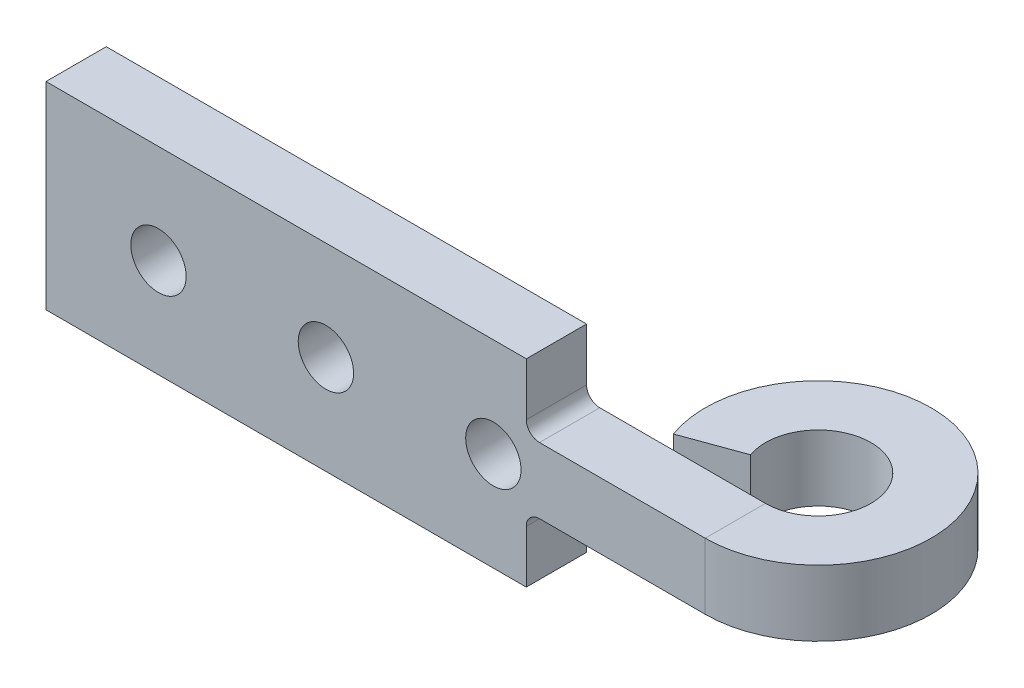
from build123d import *

# Parameters (mm, degrees)
BASE_FLANGE1_DEPTH      = 15
CUT_EXTRUDE1_DEPTH      = 14
CUT_EXTRUDE1_DEPTH_BACK = 10
SKETCH6_W               = 22.14
SKETCH6_H               = 5
SKETCH7_R               = 2.1
CUT_EXTRUDE2_DEPTH      = 10
FILLET2_R               = 1


# Sheet-metal steps are written as plain solids
with BuildPart() as part:
    # Sketch1 → Base-Flange1 (new body)
    with BuildSketch(Plane(origin=(0, 0, 0), x_dir=(1, 0, 0), z_dir=(0, 1, 0))):
        with BuildLine():
            Line((0, 0), (50, 0))
            ThreePointArc((50, 0), (52.294305745, 7.276608177), (46.241229517, 2.631919427))
            Line((46.241229517, 2.631919427), (41.94683424, 1.068887372))
            ThreePointArc((41.94683424, 1.068887372), (54.91555006, 11.02013302), (50, -4.57))
            Line((50, -4.57), (0, -4.57))
            Line((0, -4.57), (0, 0))
        make_face()
    extrude(amount=BASE_FLANGE1_DEPTH)

    # Sketch6 → Cut-Extrude1 (cut, two sides: drawn at the far end of the back side and taken through both)
    with BuildSketch(Plane(origin=(0, 0, 0), x_dir=(-1, 0, 0), z_dir=(0, 0, -1)).offset(-CUT_EXTRUDE1_DEPTH_BACK)):
        with Locations((-47.5, 12.5)):
            Rectangle(SKETCH6_W, SKETCH6_H)
        with Locations((-47.5, 2.5)):
            Rectangle(SKETCH6_W, SKETCH6_H)
    extrude(amount=CUT_EXTRUDE1_DEPTH + CUT_EXTRUDE1_DEPTH_BACK, mode=Mode.SUBTRACT)

    # Sketch7 → Cut-Extrude2 (cut)
    with BuildSketch(Plane(origin=(0, 0, 0), x_dir=(-1, 0, 0), z_dir=(0, 0, -1))):
        with Locations((-21.23, 7.5)):
            Circle(SKETCH7_R)
        with Locations((-33.93, 7.5)):
            Circle(SKETCH7_R)
        with Locations((-8.53, 7.5)):
            Circle(SKETCH7_R)
    extrude(amount=-CUT_EXTRUDE2_DEPTH, mode=Mode.SUBTRACT)

    # Fillet2
    fillet2_edges = [part.edges().sort_by_distance(p)[0] for p in [
        (36.43, 10, 2.285),
        (36.43, 5, 2.285),
    ]]
    fillet(fillet2_edges, radius=FILLET2_R)


solid = part.part
